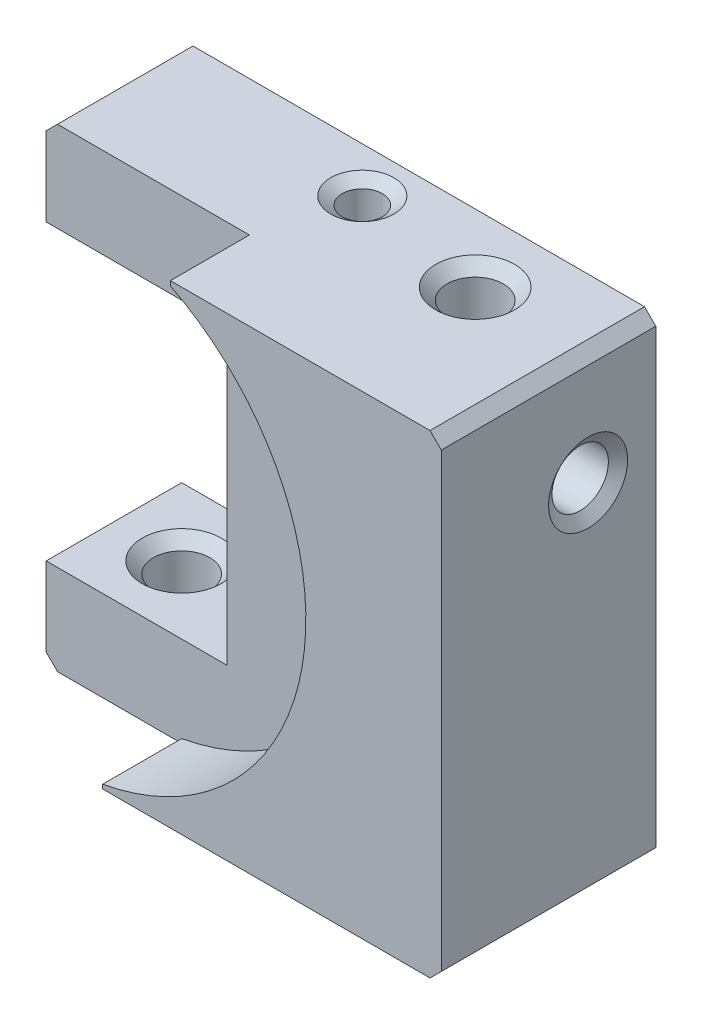
from build123d import *

# Parameters (mm, degrees)
SKETCH_1_W                    = 21
SKETCH_1_H                    = 21
EXTRUDE_1_DEPTH               = 9.5
CUT_EXTRUDE_3_DEPTH           = 3.5
CUT_EXTRUDE_4_DEPTH           = 18.628102564
CHAMFER_1_SIZE                = 0.5
HOLE_WIZARD_2_561_D           = 1.778
HOLE_WIZARD_2_561_DEPTH       = 8.27
HOLE_WIZARD_2_561_CSINK_D     = 2.794
HOLE_WIZARD_2_561_CSINK_ANGLE = 110
HOLE_WIZARD_2_561_TIP         = 0.53416509


# Read off the part's stored shape, not the designer's step: Отверстие обработанное метчиком M31, Отверстие обработанное метчиком M32
with BuildPart() as part:
    # Эскиз1 → Бобышка-Вытянуть1 (new body)
    with BuildSketch(Plane.XY):
        Rectangle(SKETCH_1_W, SKETCH_1_H)
    extrude(amount=EXTRUDE_1_DEPTH)

    # Эскиз2 → Вырез-Вытянуть3 (cut)
    with BuildSketch(Plane.XY.offset(9.5)):
        with BuildLine():
            ThreePointArc((-4.5, -10.316653826), (4.385337165, -1.084119567), (-1.5, 10.297958971))
            Line((-1.5, 10.297958971), (-1.5, 10.5))
            Line((-1.5, 10.5), (-10.5, 10.5))
            Line((-10.5, 10.5), (-10.5, -10.5))
            Line((-10.5, -10.5), (-4.5, -10.5))
            Line((-4.5, -10.5), (-4.5, -10.316653826))
        make_face()
    extrude(amount=-CUT_EXTRUDE_3_DEPTH, mode=Mode.SUBTRACT)

    # Эскиз3 → Вырез-Вытянуть4 (cut, through all)
    with BuildSketch(Plane(origin=(0, 0, 0), x_dir=(-1, 0, 0), z_dir=(0, 0, -1))):
        Polygon((74.537024344, 6.5), (10.5, 6.5), (2.5, 6.5), (2.5, -6.5), (10.5, -6.5), (74.537024344, -6.5), (202.611073033, -6.5), (202.611073033, 6.5), align=None)
    extrude(amount=-CUT_EXTRUDE_4_DEPTH, mode=Mode.SUBTRACT)

    # Отверстие обработанное метчиком M31 outline → Отверстие обработанное метчиком M31 (revolve, cut)
    with BuildSketch(Plane(origin=(5.5, 0, 3), x_dir=(1, 0, 0), z_dir=(0, 0, 1))):
        Polygon((1.75, 10.5), (0, 10.5), (0, -10.5), (1.75, -10.5), (1.25, -10.149896231), (1.25, 10), align=None)
    revolve(axis=Axis((5.5, 0, 3), (0, 1, 0)), mode=Mode.SUBTRACT)

    # Hole Wizard M31 2 outline → Hole Wizard M31 2 (revolve, cut)
    with BuildSketch(Plane(origin=(-7.5, 0, 3), x_dir=(1, 0, 0), z_dir=(0, 0, 1))):
        Polygon((1.75, -6.5), (0, -6.5), (0, -10.5), (1.75, -10.5), (1.25, -10.149896231), (1.25, -7), align=None)
    revolve(axis=Axis((-7.5, 0, 3), (0, 1, 0)), mode=Mode.SUBTRACT)

    # Фаска1
    chamfer_1_edges = [part.edges().sort_by_distance(p)[0] for p in [
        (-10.5, -10.5, 3),
        (-10.5, 10.5, 3),
        (10.5, -10.5, 4.75),
        (10.5, 10.5, 4.75),
    ]]
    chamfer(chamfer_1_edges, length=CHAMFER_1_SIZE)

    # Отверстие обработанное метчиком #2-561
    with Locations(Plane(origin=(0, 10.5, 0), x_dir=(-1, 0, 0), z_dir=(0, 1, 0))):
        with Locations((0.5, 2)):
            CounterSinkHole(HOLE_WIZARD_2_561_D / 2, HOLE_WIZARD_2_561_CSINK_D / 2, depth=HOLE_WIZARD_2_561_DEPTH, counter_sink_angle=HOLE_WIZARD_2_561_CSINK_ANGLE)
            with Locations((0, 0, -(HOLE_WIZARD_2_561_DEPTH + HOLE_WIZARD_2_561_TIP / 2))):  # 118° drill point
                Cone(0, HOLE_WIZARD_2_561_D / 2, HOLE_WIZARD_2_561_TIP, mode=Mode.SUBTRACT)

    # Отверстие обработанное метчиком M32 outline → Отверстие обработанное метчиком M32 (revolve, cut)
    with BuildSketch(Plane(origin=(0, 5.5, 3), x_dir=(0, 1, 0), z_dir=(0, 0, -1))):
        Polygon((0, 5.5), (1.25, 5.5), (1.25, 10.149896231), (1.75, 10.5), (0, 10.5), align=None)
    revolve(axis=Axis((0, 5.5, 3), (1, 0, 0)), mode=Mode.SUBTRACT)


solid = part.part
